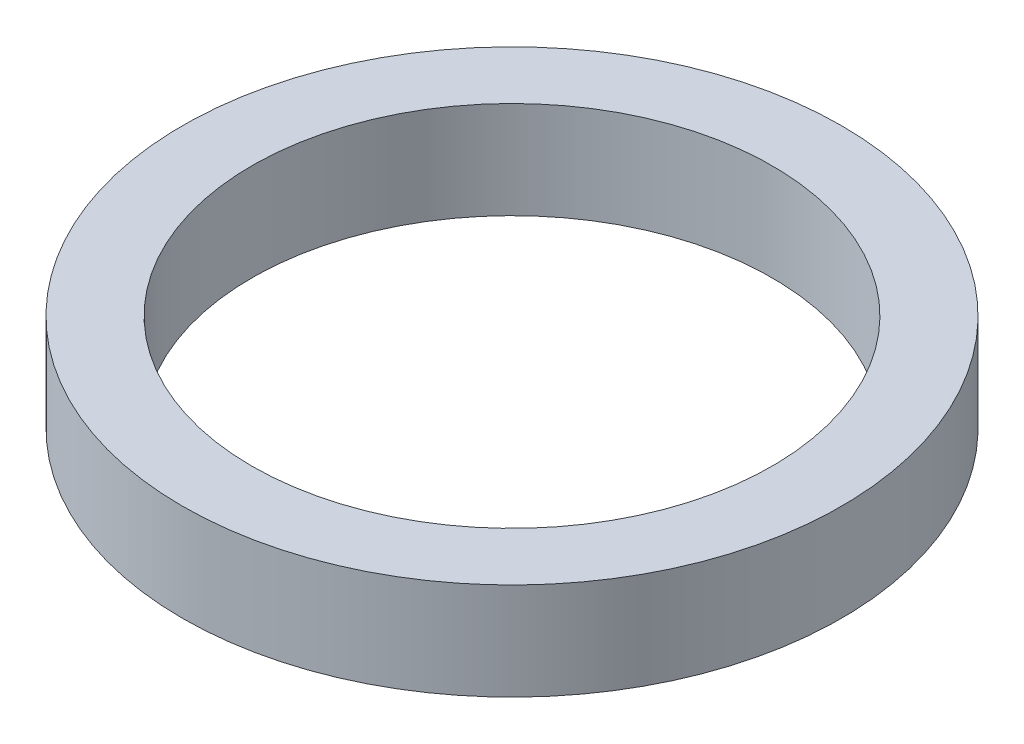
from build123d import *

# Parameters (mm, degrees)
SKETCH1_R           = 47.5
BOSS_EXTRUDE1_DEPTH = 14
SKETCH2_R           = 37.5
CUT_EXTRUDE1_DEPTH  = 69.618510622


with BuildPart() as part:
    # Sketch1 → Boss-Extrude1 (new body)
    with BuildSketch(Plane(origin=(0, 0, 0), x_dir=(1, 0, 0), z_dir=(0, 1, 0))):
        Circle(SKETCH1_R)
    extrude(amount=BOSS_EXTRUDE1_DEPTH)

    # Sketch2 → Cut-Extrude1 (cut, through all)
    with BuildSketch(Plane(origin=(0, 0, 0), x_dir=(1, 0, 0), z_dir=(0, 1, 0))):
        Circle(SKETCH2_R)
    extrude(amount=CUT_EXTRUDE1_DEPTH, mode=Mode.SUBTRACT)


solid = part.part
